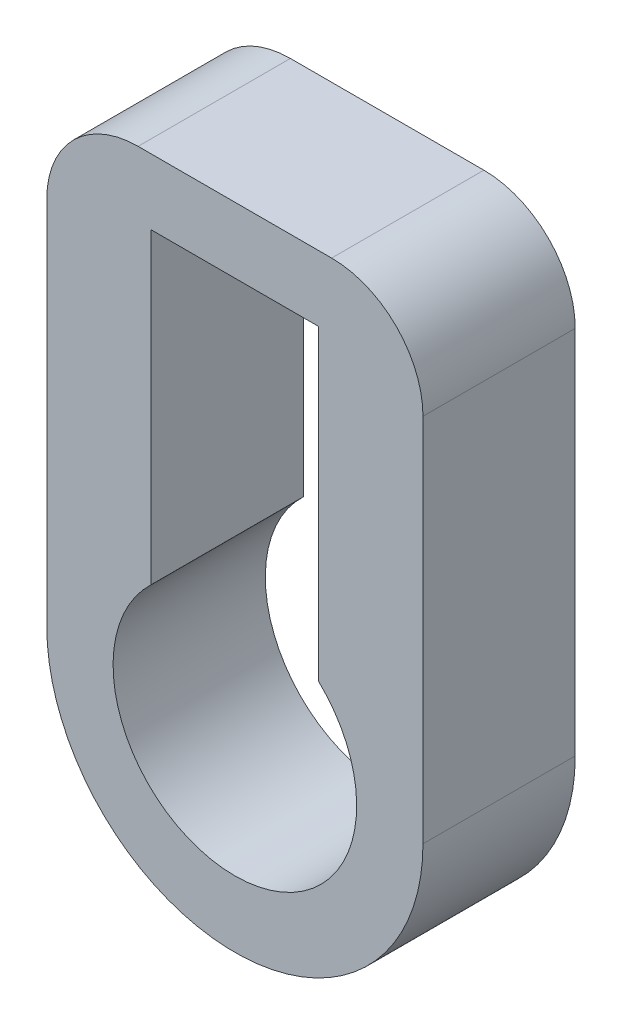
from build123d import *

# Parameters (mm, degrees)
BOSS_EXTRUDE1_DEPTH = 1.27
SKETCH2_R           = 1.016
CUT_EXTRUDE1_DEPTH  = 2.54
FILLET2_R           = 0.762


with BuildPart() as part:
    # Sketch1 → Boss-Extrude1 (new body)
    with BuildSketch(Plane.XY):
        with BuildLine():
            Line((-1.569016559, 3.850479464), (-1.569016559, 0))
            ThreePointArc((-1.569016559, 0), (0, -1.569016559), (1.569016559, 0))
            Line((1.569016559, 0), (1.569016559, 3.850479464))
            Line((1.569016559, 3.850479464), (-1.569016559, 3.850479464))
        make_face()
        with BuildLine():
            Line((-0.6985, 3.302), (0.6985, 3.302))
            Line((0.6985, 3.302), (0.6985, 0))
            ThreePointArc((0.6985, 0), (0, -0.6985), (-0.6985, 0))
            Line((-0.6985, 0), (-0.6985, 3.302))
        make_face(mode=Mode.SUBTRACT)
    extrude(amount=BOSS_EXTRUDE1_DEPTH)

    # Sketch2 → Cut-Extrude1 (cut)
    with BuildSketch(Plane(origin=(0, 0, 0), x_dir=(-1, 0, 0), z_dir=(0, 0, -1))):
        Circle(SKETCH2_R)
    extrude(amount=-CUT_EXTRUDE1_DEPTH, mode=Mode.SUBTRACT)

    # Fillet2
    fillet2_edges = [part.edges().sort_by_distance(p)[0] for p in [
        (-1.569016559, 3.850479464, 0.635),
        (1.569016559, 3.850479464, 0.635),
    ]]
    fillet(fillet2_edges, radius=FILLET2_R)


solid = part.part
